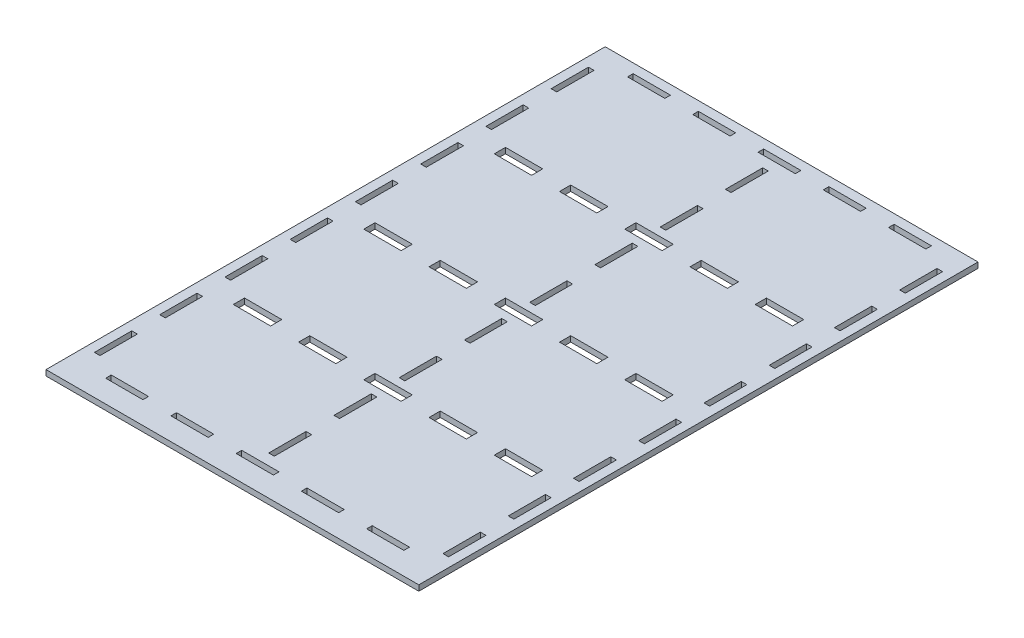
from build123d import *

# Parameters (mm, degrees)
SKETCH1_W             = 200
SKETCH1_H             = 300
SKETCH1_W_2           = 20
SKETCH1_H_2           = 3
SKETCH1_W_3           = 3
SKETCH1_H_3           = 20
BOSS_EXTRUDE1_DEPTH   = 3
SKETCH2_W             = 20
SKETCH2_H             = 3
SKETCH2_W_2           = 3
SKETCH2_H_2           = 20
CUT_EXTRUDE2_DEPTH    = 10
LPATTERN3_START       = 55
LPATTERN3_OUTLINE_W   = 3
LPATTERN3_OUTLINE_H   = 3
LPATTERN3_DEPTH       = 20
LPATTERN3_START_2     = 90
LPATTERN3_2_OUTLINE_W = 3
LPATTERN3_2_OUTLINE_H = 3
LPATTERN3_2_DEPTH     = 20
LPATTERN3_START_3     = 125
LPATTERN3_3_OUTLINE_W = 3
LPATTERN3_3_OUTLINE_H = 3
LPATTERN3_3_DEPTH     = 20
LPATTERN3_START_4     = 160
LPATTERN3_4_OUTLINE_W = 3
LPATTERN3_4_OUTLINE_H = 3
LPATTERN3_4_DEPTH     = 20
LPATTERN3_START_5     = 20
LPATTERN3_5_OUTLINE_W = 3
LPATTERN3_5_OUTLINE_H = 3
LPATTERN3_5_DEPTH     = 20
LPATTERN4_START       = -251
LPATTERN4_OUTLINE_W   = 3
LPATTERN4_OUTLINE_H   = 3
LPATTERN4_DEPTH       = 20
LPATTERN4_START_2     = -216
LPATTERN4_2_OUTLINE_W = 3
LPATTERN4_2_OUTLINE_H = 3
LPATTERN4_2_DEPTH     = 20
LPATTERN4_START_3     = -181
LPATTERN4_3_OUTLINE_W = 3
LPATTERN4_3_OUTLINE_H = 3
LPATTERN4_3_DEPTH     = 20
LPATTERN4_START_4     = -146
LPATTERN4_4_OUTLINE_W = 3
LPATTERN4_4_OUTLINE_H = 3
LPATTERN4_4_DEPTH     = 20
LPATTERN4_START_5     = -111
LPATTERN4_5_OUTLINE_W = 3
LPATTERN4_5_OUTLINE_H = 3
LPATTERN4_5_DEPTH     = 20
LPATTERN4_START_6     = -76
LPATTERN4_6_OUTLINE_W = 3
LPATTERN4_6_OUTLINE_H = 3
LPATTERN4_6_DEPTH     = 20
LPATTERN4_START_7     = -41
LPATTERN4_7_OUTLINE_W = 3
LPATTERN4_7_OUTLINE_H = 3
LPATTERN4_7_DEPTH     = 20
LPATTERN4_START_8     = -286
LPATTERN4_8_OUTLINE_W = 3
LPATTERN4_8_OUTLINE_H = 3
LPATTERN4_8_DEPTH     = 20
SKETCH4_W             = 20
SKETCH4_H             = 6
CUT_EXTRUDE3_DEPTH    = 10
LPATTERN5_COUNT       = 5
LPATTERN5_PITCH       = 35
LPATTERN5_COUNT_DIR2  = 3
LPATTERN5_PITCH_DIR2  = 70


# Read off the part's stored shape, not the designer's step: LPattern3, LPattern4
with BuildPart() as part:
    # Sketch1 → Boss-Extrude1 (new body)
    # profile 1 of 3: a face of its own
    with BuildSketch(Plane(origin=(0, 0, 0), x_dir=(1, 0, 0), z_dir=(0, 1, 0))):
        with Locations((100, 150)):
            Rectangle(SKETCH1_W, SKETCH1_H)
        with Locations((30, 293.5)):
            Rectangle(SKETCH1_W_2, SKETCH1_H_2, mode=Mode.SUBTRACT)
        with Locations((6.5, 276)):
            Rectangle(SKETCH1_W_3, SKETCH1_H_3, mode=Mode.SUBTRACT)
    # profile 2 of 3: a face of its own
    with BuildSketch(Plane(origin=(0, 0, 0), x_dir=(1, 0, 0), z_dir=(0, 1, 0))):
        with Locations((30, 293.5)):
            Rectangle(SKETCH1_W_2, SKETCH1_H_2)
    # profile 3 of 3: a face of its own
    with BuildSketch(Plane(origin=(0, 0, 0), x_dir=(1, 0, 0), z_dir=(0, 1, 0))):
        with Locations((6.5, 276)):
            Rectangle(SKETCH1_W_3, SKETCH1_H_3)
    extrude(amount=BOSS_EXTRUDE1_DEPTH)

    # Sketch2 → Cut-Extrude2 (cut)
    with BuildSketch(Plane(origin=(0, 3, 0), x_dir=(1, 0, 0), z_dir=(0, 1, 0))):
        with Locations((30, 293.5)):
            Rectangle(SKETCH2_W, SKETCH2_H)
        with Locations((6.5, 276)):
            Rectangle(SKETCH2_W_2, SKETCH2_H_2)
    extrude(amount=-CUT_EXTRUDE2_DEPTH, mode=Mode.SUBTRACT)

    # LPattern3 outline → LPattern3 (cut)
    with BuildSketch(Plane.YZ.offset(LPATTERN3_START)):
        with Locations((1.5, -13.5)):
            Rectangle(LPATTERN3_OUTLINE_W, LPATTERN3_OUTLINE_H)
        with Locations((1.5, -83.5)):
            Rectangle(LPATTERN3_OUTLINE_W, LPATTERN3_OUTLINE_H)
        with Locations((1.5, -153.5)):
            Rectangle(LPATTERN3_OUTLINE_W, LPATTERN3_OUTLINE_H)
        with Locations((1.5, -223.5)):
            Rectangle(LPATTERN3_OUTLINE_W, LPATTERN3_OUTLINE_H)
        with Locations((1.5, -293.5)):
            Rectangle(LPATTERN3_OUTLINE_W, LPATTERN3_OUTLINE_H)
    extrude(amount=LPATTERN3_DEPTH, mode=Mode.SUBTRACT)

    # LPattern3 2 outline → LPattern3 2 (cut)
    with BuildSketch(Plane.YZ.offset(LPATTERN3_START_2)):
        with Locations((1.5, -13.5)):
            Rectangle(LPATTERN3_2_OUTLINE_W, LPATTERN3_2_OUTLINE_H)
        with Locations((1.5, -83.5)):
            Rectangle(LPATTERN3_2_OUTLINE_W, LPATTERN3_2_OUTLINE_H)
        with Locations((1.5, -153.5)):
            Rectangle(LPATTERN3_2_OUTLINE_W, LPATTERN3_2_OUTLINE_H)
        with Locations((1.5, -223.5)):
            Rectangle(LPATTERN3_2_OUTLINE_W, LPATTERN3_2_OUTLINE_H)
        with Locations((1.5, -293.5)):
            Rectangle(LPATTERN3_2_OUTLINE_W, LPATTERN3_2_OUTLINE_H)
    extrude(amount=LPATTERN3_2_DEPTH, mode=Mode.SUBTRACT)

    # LPattern3 3 outline → LPattern3 3 (cut)
    with BuildSketch(Plane.YZ.offset(LPATTERN3_START_3)):
        with Locations((1.5, -13.5)):
            Rectangle(LPATTERN3_3_OUTLINE_W, LPATTERN3_3_OUTLINE_H)
        with Locations((1.5, -83.5)):
            Rectangle(LPATTERN3_3_OUTLINE_W, LPATTERN3_3_OUTLINE_H)
        with Locations((1.5, -153.5)):
            Rectangle(LPATTERN3_3_OUTLINE_W, LPATTERN3_3_OUTLINE_H)
        with Locations((1.5, -223.5)):
            Rectangle(LPATTERN3_3_OUTLINE_W, LPATTERN3_3_OUTLINE_H)
        with Locations((1.5, -293.5)):
            Rectangle(LPATTERN3_3_OUTLINE_W, LPATTERN3_3_OUTLINE_H)
    extrude(amount=LPATTERN3_3_DEPTH, mode=Mode.SUBTRACT)

    # LPattern3 4 outline → LPattern3 4 (cut)
    with BuildSketch(Plane.YZ.offset(LPATTERN3_START_4)):
        with Locations((1.5, -13.5)):
            Rectangle(LPATTERN3_4_OUTLINE_W, LPATTERN3_4_OUTLINE_H)
        with Locations((1.5, -83.5)):
            Rectangle(LPATTERN3_4_OUTLINE_W, LPATTERN3_4_OUTLINE_H)
        with Locations((1.5, -153.5)):
            Rectangle(LPATTERN3_4_OUTLINE_W, LPATTERN3_4_OUTLINE_H)
        with Locations((1.5, -223.5)):
            Rectangle(LPATTERN3_4_OUTLINE_W, LPATTERN3_4_OUTLINE_H)
        with Locations((1.5, -293.5)):
            Rectangle(LPATTERN3_4_OUTLINE_W, LPATTERN3_4_OUTLINE_H)
    extrude(amount=LPATTERN3_4_DEPTH, mode=Mode.SUBTRACT)

    # LPattern3 5 outline → LPattern3 5 (cut)
    with BuildSketch(Plane.YZ.offset(LPATTERN3_START_5)):
        with Locations((1.5, -13.5)):
            Rectangle(LPATTERN3_5_OUTLINE_W, LPATTERN3_5_OUTLINE_H)
        with Locations((1.5, -83.5)):
            Rectangle(LPATTERN3_5_OUTLINE_W, LPATTERN3_5_OUTLINE_H)
        with Locations((1.5, -153.5)):
            Rectangle(LPATTERN3_5_OUTLINE_W, LPATTERN3_5_OUTLINE_H)
        with Locations((1.5, -223.5)):
            Rectangle(LPATTERN3_5_OUTLINE_W, LPATTERN3_5_OUTLINE_H)
    extrude(amount=LPATTERN3_5_DEPTH, mode=Mode.SUBTRACT)

    # LPattern4 outline → LPattern4 (cut)
    with BuildSketch(Plane.XY.offset(LPATTERN4_START)):
        with Locations((193.5, 1.5)):
            Rectangle(LPATTERN4_OUTLINE_W, LPATTERN4_OUTLINE_H)
        with Locations((100, 1.5)):
            Rectangle(LPATTERN4_OUTLINE_W, LPATTERN4_OUTLINE_H)
        with Locations((6.5, 1.5)):
            Rectangle(LPATTERN4_OUTLINE_W, LPATTERN4_OUTLINE_H)
    extrude(amount=LPATTERN4_DEPTH, mode=Mode.SUBTRACT)

    # LPattern4 2 outline → LPattern4 2 (cut)
    with BuildSketch(Plane.XY.offset(LPATTERN4_START_2)):
        with Locations((193.5, 1.5)):
            Rectangle(LPATTERN4_2_OUTLINE_W, LPATTERN4_2_OUTLINE_H)
        with Locations((100, 1.5)):
            Rectangle(LPATTERN4_2_OUTLINE_W, LPATTERN4_2_OUTLINE_H)
        with Locations((6.5, 1.5)):
            Rectangle(LPATTERN4_2_OUTLINE_W, LPATTERN4_2_OUTLINE_H)
    extrude(amount=LPATTERN4_2_DEPTH, mode=Mode.SUBTRACT)

    # LPattern4 3 outline → LPattern4 3 (cut)
    with BuildSketch(Plane.XY.offset(LPATTERN4_START_3)):
        with Locations((193.5, 1.5)):
            Rectangle(LPATTERN4_3_OUTLINE_W, LPATTERN4_3_OUTLINE_H)
        with Locations((100, 1.5)):
            Rectangle(LPATTERN4_3_OUTLINE_W, LPATTERN4_3_OUTLINE_H)
        with Locations((6.5, 1.5)):
            Rectangle(LPATTERN4_3_OUTLINE_W, LPATTERN4_3_OUTLINE_H)
    extrude(amount=LPATTERN4_3_DEPTH, mode=Mode.SUBTRACT)

    # LPattern4 4 outline → LPattern4 4 (cut)
    with BuildSketch(Plane.XY.offset(LPATTERN4_START_4)):
        with Locations((193.5, 1.5)):
            Rectangle(LPATTERN4_4_OUTLINE_W, LPATTERN4_4_OUTLINE_H)
        with Locations((100, 1.5)):
            Rectangle(LPATTERN4_4_OUTLINE_W, LPATTERN4_4_OUTLINE_H)
        with Locations((6.5, 1.5)):
            Rectangle(LPATTERN4_4_OUTLINE_W, LPATTERN4_4_OUTLINE_H)
    extrude(amount=LPATTERN4_4_DEPTH, mode=Mode.SUBTRACT)

    # LPattern4 5 outline → LPattern4 5 (cut)
    with BuildSketch(Plane.XY.offset(LPATTERN4_START_5)):
        with Locations((193.5, 1.5)):
            Rectangle(LPATTERN4_5_OUTLINE_W, LPATTERN4_5_OUTLINE_H)
        with Locations((100, 1.5)):
            Rectangle(LPATTERN4_5_OUTLINE_W, LPATTERN4_5_OUTLINE_H)
        with Locations((6.5, 1.5)):
            Rectangle(LPATTERN4_5_OUTLINE_W, LPATTERN4_5_OUTLINE_H)
    extrude(amount=LPATTERN4_5_DEPTH, mode=Mode.SUBTRACT)

    # LPattern4 6 outline → LPattern4 6 (cut)
    with BuildSketch(Plane.XY.offset(LPATTERN4_START_6)):
        with Locations((193.5, 1.5)):
            Rectangle(LPATTERN4_6_OUTLINE_W, LPATTERN4_6_OUTLINE_H)
        with Locations((100, 1.5)):
            Rectangle(LPATTERN4_6_OUTLINE_W, LPATTERN4_6_OUTLINE_H)
        with Locations((6.5, 1.5)):
            Rectangle(LPATTERN4_6_OUTLINE_W, LPATTERN4_6_OUTLINE_H)
    extrude(amount=LPATTERN4_6_DEPTH, mode=Mode.SUBTRACT)

    # LPattern4 7 outline → LPattern4 7 (cut)
    with BuildSketch(Plane.XY.offset(LPATTERN4_START_7)):
        with Locations((193.5, 1.5)):
            Rectangle(LPATTERN4_7_OUTLINE_W, LPATTERN4_7_OUTLINE_H)
        with Locations((100, 1.5)):
            Rectangle(LPATTERN4_7_OUTLINE_W, LPATTERN4_7_OUTLINE_H)
        with Locations((6.5, 1.5)):
            Rectangle(LPATTERN4_7_OUTLINE_W, LPATTERN4_7_OUTLINE_H)
    extrude(amount=LPATTERN4_7_DEPTH, mode=Mode.SUBTRACT)

    # LPattern4 8 outline → LPattern4 8 (cut)
    with BuildSketch(Plane.XY.offset(LPATTERN4_START_8)):
        with Locations((193.5, 1.5)):
            Rectangle(LPATTERN4_8_OUTLINE_W, LPATTERN4_8_OUTLINE_H)
        with Locations((100, 1.5)):
            Rectangle(LPATTERN4_8_OUTLINE_W, LPATTERN4_8_OUTLINE_H)
    extrude(amount=LPATTERN4_8_DEPTH, mode=Mode.SUBTRACT)

    # Sketch4 → Cut-Extrude3 (cut)
    with BuildSketch(Plane(origin=(0, 3, 0), x_dir=(1, 0, 0), z_dir=(0, 1, 0))):
        with Locations((30, 223.5)):
            Rectangle(SKETCH4_W, SKETCH4_H)
    cut_extrude3 = extrude(amount=-CUT_EXTRUDE3_DEPTH, mode=Mode.SUBTRACT)

    # LPattern5: Cut-Extrude3 5 × 3
    with Locations(*[(i * LPATTERN5_PITCH, 0, j * LPATTERN5_PITCH_DIR2) for i in range(LPATTERN5_COUNT) for j in range(LPATTERN5_COUNT_DIR2) if (i, j) != (0, 0)]):
        add(cut_extrude3, mode=Mode.SUBTRACT)


solid = part.part
